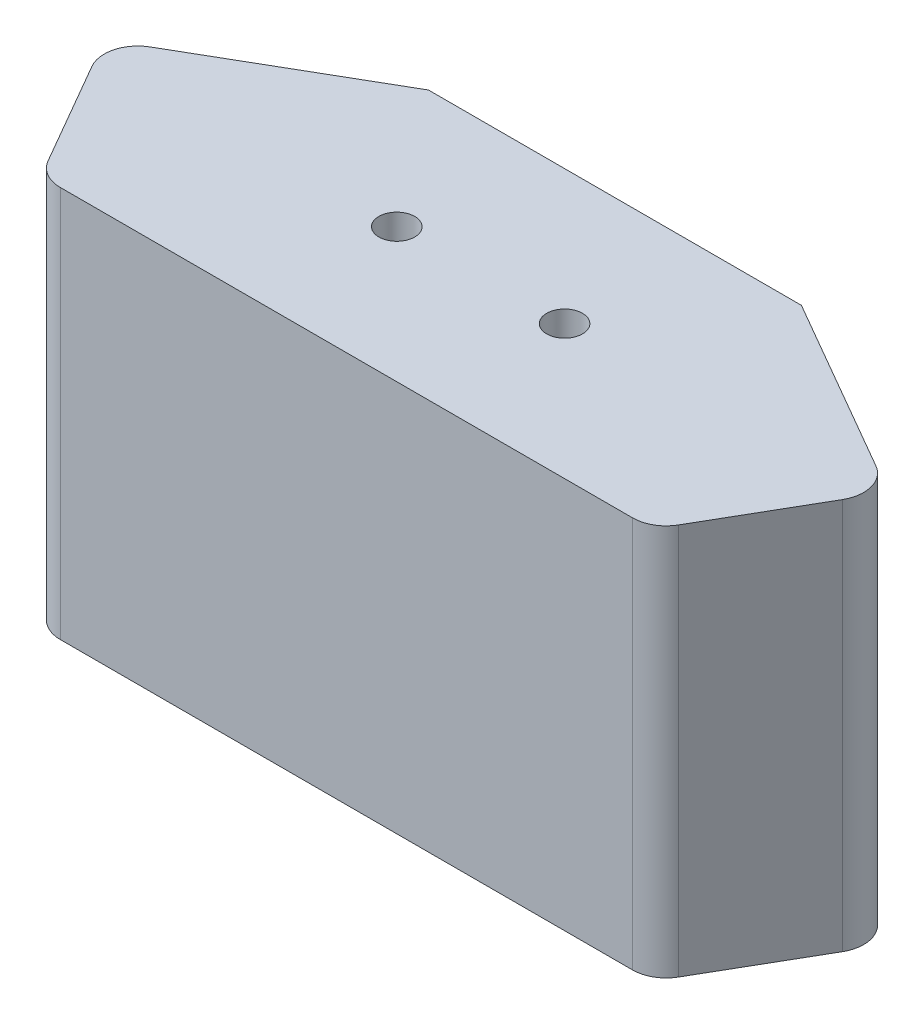
from build123d import *

# Parameters (mm, degrees)
EXTRUDE_1_DEPTH              = 35
SKETCH_2_R                   = 4.5
CUT_EXTRUDE_1_DEPTH          = 27
HOLE_WIZARD_M3_1_D           = 3.2
HOLE_WIZARD_M3_1_CSINK_D     = 6.6
HOLE_WIZARD_M3_1_CSINK_ANGLE = 90
FILLET_1_R                   = 3


with BuildPart() as part:
    # 草圖1 → 填料-伸長1 (new body)
    with BuildSketch(Plane(origin=(0, 0, 0), x_dir=(1, 0, 0), z_dir=(0, 1, 0))):
        Polygon((-2.309401077, -4), (52.309401077, -4), (60.04102232, 9.391560818), (56.576920705, 11.391560818), (41.666666667, 20), (8.333333333, 20), (-10.04102232, 9.391560818), align=None)
    extrude(amount=EXTRUDE_1_DEPTH)

    # 草圖2 → 除料-伸長1 (cut)
    with BuildSketch(Plane.XZ):
        with Locations((17.5, -8)):
            Circle(SKETCH_2_R)
        with Locations((32.5, -8)):
            Circle(SKETCH_2_R)
    extrude(amount=-CUT_EXTRUDE_1_DEPTH, mode=Mode.SUBTRACT)

    # M3 十字槽沉頭木螺釘的錐孔1 (through all)
    with Locations(Plane(origin=(17.5, 27, -8), x_dir=(0, 0, -1), z_dir=(0, -1, 0))):
        with Locations((0, 0), (0, 15)):
            CounterSinkHole(HOLE_WIZARD_M3_1_D / 2, HOLE_WIZARD_M3_1_CSINK_D / 2, counter_sink_angle=HOLE_WIZARD_M3_1_CSINK_ANGLE)

    # 圓角1
    fillet_1_edges = [part.edges().sort_by_distance(p)[0] for p in [
        (-10.04102232, 17.5, -9.391560818),
        (60.04102232, 17.5, -9.391560818),
        (-2.309401077, 17.5, 4),
        (52.309401077, 17.5, 4),
    ]]
    fillet(fillet_1_edges, radius=FILLET_1_R)


solid = part.part
